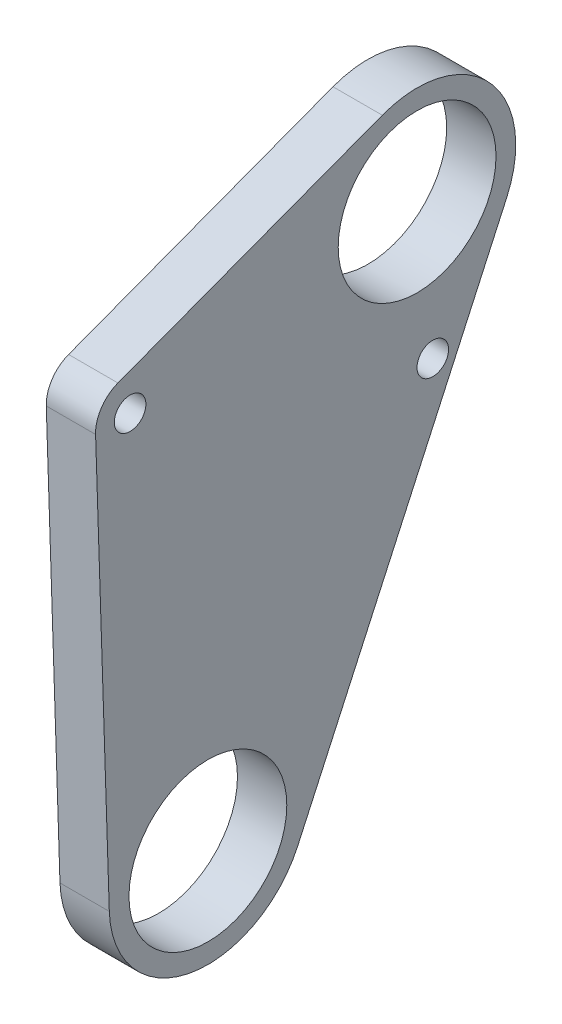
from build123d import *

# Parameters (mm, degrees)
BOSS_EXTRUDE1_START  = -11.3
SKETCH2_R            = 8
BOSS_EXTRUDE1_DEPTH  = 5
BOSS_EXTRUDE2_START  = -11.3
BOSS_EXTRUDE2_DEPTH  = 5
CUT_EXTRUDE2_START   = -11.3
CUT_EXTRUDE2_DEPTH   = 1
M3_CLEARANCE_HOLE1_D = 3.2
M3_CLEARANCE_HOLE2_D = 3.2


# Read off the part's stored shape, not the designer's step: Intersect1
with BuildPart() as part:
    # Sketch2 → Boss-Extrude1 (new body)
    with BuildSketch(Plane(origin=(0, 0, 0), x_dir=(0, 0, -1), z_dir=(1, 0, 0)).offset(BOSS_EXTRUDE1_START)):
        with BuildLine():
            Line((9.0940801, -4.15905123), (-12.117081171, -50.538859741))
            ThreePointArc((-12.117081171, -50.538859741), (-25.370212501, -55.473888611), (-30.305241372, -42.220757281))
            Line((-30.305241372, -42.220757281), (-9.0940801, 4.15905123))
            ThreePointArc((-9.0940801, 4.15905123), (4.15905123, 9.0940801), (9.0940801, -4.15905123))
        make_face()
        with Locations((-21.211161271, -46.379808511)):
            Circle(SKETCH2_R, mode=Mode.SUBTRACT)
        Circle(SKETCH2_R, mode=Mode.SUBTRACT)
    boss_extrude1 = extrude(amount=-BOSS_EXTRUDE1_DEPTH)

    # Sketch2<3> → Boss-Extrude2 (add)
    with BuildSketch(Plane(origin=(0, 0, 0), x_dir=(0, 0, -1), z_dir=(1, 0, 0)).offset(BOSS_EXTRUDE2_START)):
        with BuildLine():
            ThreePointArc((-9.0940801, 4.15905123), (-6.824825213, 7.309019141), (-3.526945256, 9.357385167))
            Line((-3.526945256, 9.357385167), (-30.332118628, -0.745905163))
            ThreePointArc((-30.332118628, -0.745905163), (-32.00821012, -2.077061023), (-32.595823612, -4.135208005))
            Line((-32.595823612, -4.135208005), (-31.205835053, -46.706145748))
            ThreePointArc((-31.205835053, -46.706145748), (-31.015487287, -44.411257932), (-30.305241372, -42.220757281))
            Line((-30.305241372, -42.220757281), (-9.0940801, 4.15905123))
        make_face()
    boss_extrude2 = extrude(amount=-BOSS_EXTRUDE2_DEPTH)

    # Sketch2<6> → Cut-Extrude2 (cut)
    with BuildSketch(Plane(origin=(0, 0, 0), x_dir=(0, 0, -1), z_dir=(1, 0, 0)).offset(CUT_EXTRUDE2_START)):
        with BuildLine():
            Line((2.200817213, -19.231691933), (5.528058196, -11.956427853))
            Line((5.528058196, -11.956427853), (3.553212429, -11.053259569))
            ThreePointArc((3.553212429, -11.053259569), (0.981018146, -9.876902238), (-0.195339185, -12.449096521))
            Line((-0.195339185, -12.449096521), (-1.169865506, -14.579972035))
            ThreePointArc((-1.169865506, -14.579972035), (-2.346222837, -17.152166318), (0.225971446, -18.328523649))
            Line((0.225971446, -18.328523649), (2.200817213, -19.231691933))
        make_face()
    cut_extrude2 = extrude(amount=-CUT_EXTRUDE2_DEPTH, mode=Mode.SUBTRACT)

    # M3 Clearance Hole1 (through all)
    with Locations(Plane(origin=(-11.3, 0, 0), x_dir=(0, 0, 1), z_dir=(1, 0, 0))):
        with Locations((29.097687789, 4.020989972)):
            m3_clearance_hole1 = Hole(M3_CLEARANCE_HOLE1_D / 2)

    # M3 Clearance Hole2 (through all)
    with Locations(Plane.ZY.offset(16.3)):
        with Locations((-1.590917679, -14.554297085)):
            m3_clearance_hole2 = Hole(M3_CLEARANCE_HOLE2_D / 2)

    # Mirror2: Boss-Extrude1, Boss-Extrude2, Cut-Extrude2, M3 Clearance Hole1, M3 Clearance Hole2 across plane
    add(boss_extrude1.mirror(Plane.ZY.offset(16.3)))
    add(boss_extrude2.mirror(Plane.ZY.offset(16.3)))
    add(cut_extrude2.mirror(Plane.ZY.offset(16.3)), mode=Mode.SUBTRACT)
    add(m3_clearance_hole1.mirror(Plane.ZY.offset(16.3)), mode=Mode.SUBTRACT)
    add(m3_clearance_hole2.mirror(Plane.ZY.offset(16.3)), mode=Mode.SUBTRACT)


with BuildPart() as body_2:
    # Intersect1: the piece on the far side of the plane
    add(part.part)
    split(bisect_by=Plane.YZ.offset(-16.3), keep=Keep.BOTTOM)


with BuildPart() as part_1:
    add(part.part)

    # Intersect1
    split(bisect_by=Plane.YZ.offset(-16.3), keep=Keep.TOP)


solid = body_2.part
